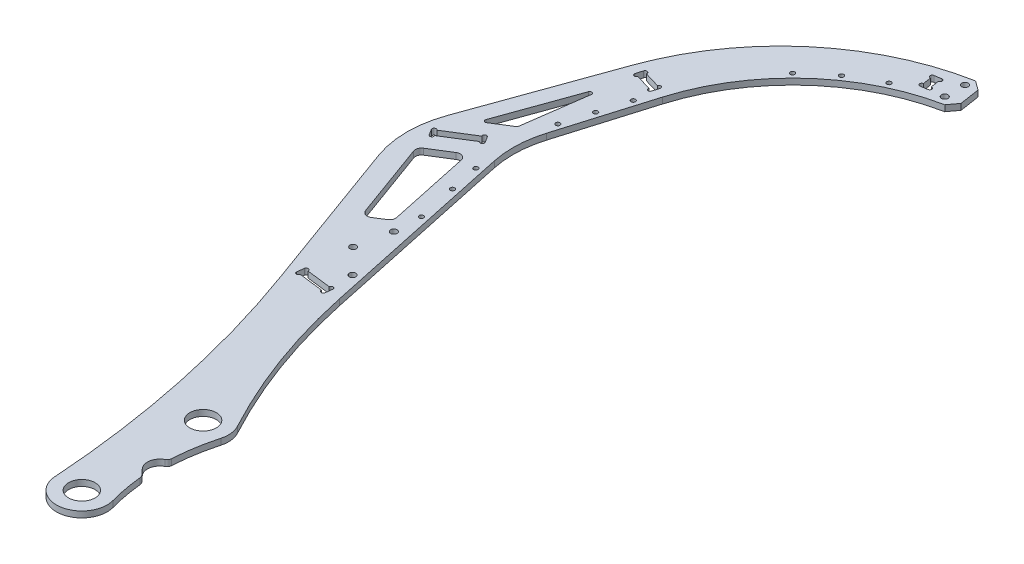
from build123d import *

# Parameters (mm, degrees)
SKETCH_3_R          = 6.55
EXTRUDE_1_DEPTH     = 1.5
CUT_EXTRUDE_3_DEPTH = 346.626566427
EXTRUDE_2_DEPTH     = 3
CHAMFER_1_SIZE      = 4
SKETCH_8_R          = 1
SKETCH_8_R_2        = 1.6
CUT_EXTRUDE_6_DEPTH = 345.981177834
SKETCH_9_R          = 1.1
SKETCH_9_R_2        = 1.6
CUT_EXTRUDE_7_DEPTH = 345.981177834
CUT_EXTRUDE_8_DEPTH = 345.981177834
FILLET_4_R          = 50
FILLET_5_R          = 3
FILLET_6_R          = 1
EXTRUDE_3_DEPTH     = 3


with BuildPart() as part:
    # 草图3 → 凸台-拉伸1 (new, symmetric)
    # profile 1 of 2: a face of its own
    with BuildSketch(Plane(origin=(0, 0, 0), x_dir=(1, 0, 0), z_dir=(0, 1, 0))):
        with BuildLine():
            ThreePointArc((11.046281859, 5.956690113), (-6.46534327, 44.807884696), (-18.295362458, 85.748365655))
            Line((-18.295362458, 85.748365655), (-41.732882117, 195.59746049))
            Line((-41.732882117, 195.59746049), (-24.830239517, 252.12165071))
            ThreePointArc((-24.830239517, 252.12165071), (4.01455016, 296.880361934), (52.313928116, 319.29763677))
            Line((52.313928116, 319.29763677), (49.5768988, 337.088327327))
            ThreePointArc((49.5768988, 337.088327327), (-8.975981148, 310.878563044), (-45.908014731, 258.424617632))
            Line((-45.908014731, 258.424617632), (-76.290123868, 173.944647702))
            Line((-76.290123868, 173.944647702), (-14.508857835, 4.202014333))
            ThreePointArc((-14.508857835, 4.202014333), (-13.227629582, 0.452324895), (-12.09596095, -3.34517992))
            ThreePointArc((-12.09596095, -3.34517992), (-4.680454366, 11.644562977), (11.046281859, 5.956690113))
        make_face()
    # profile 2 of 2: a face of its own
    with BuildSketch(Plane(origin=(0, 0, 0), x_dir=(1, 0, 0), z_dir=(0, 1, 0))):
        with BuildLine():
            ThreePointArc((12.09596095, -3.34517992), (8.478119914, -30), (12.09596095, -56.65482008))
            ThreePointArc((12.09596095, -56.65482008), (0, -72.55), (-12.09596095, -56.65482008))
            ThreePointArc((-12.09596095, -56.65482008), (-8.478119914, -30), (-12.09596095, -3.34517992))
            ThreePointArc((-12.09596095, -3.34517992), (0, 12.55), (12.09596095, -3.34517992))
        make_face()
        with Locations(Location((0, 0, 0), (0, 0, 270))):
            Circle(SKETCH_3_R, mode=Mode.SUBTRACT)
        with Locations(Location((0, -60, 0), (0, 0, 270))):
            Circle(SKETCH_3_R, mode=Mode.SUBTRACT)
    extrude(amount=EXTRUDE_1_DEPTH, both=True)

    # 草图7 → 切除-拉伸3 (cut, through all)
    with BuildSketch(Plane(origin=(0, 1.5, 0), x_dir=(1, 0, 0), z_dir=(0, 1, 0))):
        with BuildLine():
            Line((4.497487802, -34.493479197), (8.909760465, -39.281260509))
            ThreePointArc((8.909760465, -39.281260509), (8.493926314, -31.777928612), (8.642731975, -24.264556235))
            ThreePointArc((8.642731975, -24.264556235), (7.765481215, -25.952185157), (5.921402859, -26.418055622))
            ThreePointArc((5.921402859, -26.418055622), (1.171733543, -29.743809881), (4.497487802, -34.493479197))
        make_face()
    extrude(amount=-CUT_EXTRUDE_3_DEPTH, mode=Mode.SUBTRACT)

    # 草图7<3> → 凸台-拉伸2 (add)
    with BuildSketch(Plane(origin=(0, 1.5, 0), x_dir=(1, 0, 0), z_dir=(0, 1, 0))):
        with BuildLine():
            ThreePointArc((-8.909760465, -39.281260509), (-8.493926314, -31.777928612), (-8.642731975, -24.264556235))
            ThreePointArc((-8.642731975, -24.264556235), (-8.806680236, -25.524578384), (-9.419131852, -26.637878822))
            ThreePointArc((-9.419131852, -26.637878822), (-10.758632644, -29.837669281), (-10.103316411, -33.24405769))
            ThreePointArc((-10.103316411, -33.24405769), (-9.068630527, -36.176084637), (-8.909760465, -39.281260509))
        make_face()
    extrude(amount=-EXTRUDE_2_DEPTH)

    # 倒角1
    # the kernel refuses this chamfer: 4 mm, written as the material it takes off along each edge
    with BuildSketch(Plane(origin=(49.5768988, -11.786731952, -337.088327327), x_dir=(-0.9857681497508005, 0, 0.16811054380045146), z_dir=(0, 1, 0))) as chamfer_1_piece_1:
        with BuildLine():
            Line((3.936502909, 0), (CHAMFER_1_SIZE * 0.0162625743907, CHAMFER_1_SIZE * 0.999867755593))
            Line((CHAMFER_1_SIZE * 0.0162625743907, CHAMFER_1_SIZE * 0.999867755593), (0, 0))
            ThreePointArc((0, 0), (2.023873499, -0.015992695), (3.936502909, 0))
        make_face()
    extrude(amount=23.573463904, mode=Mode.SUBTRACT)
    with BuildSketch(Plane(origin=(52.313928116, -12.013080834, -319.29763677), x_dir=(-0.15205718425393844, 0, -0.9883716976506176), z_dir=(0, 1, 0))) as chamfer_1_piece_2:
        with BuildLine():
            Line((CHAMFER_1_SIZE, 0), (-0.087315026, 4.087315025))
            ThreePointArc((-0.087315026, 4.087315025), (-0.023083391, 2.101920628), (0, 0))
            Line((0, 0), (CHAMFER_1_SIZE, 0))
        make_face()
    extrude(amount=24.026161669, mode=Mode.SUBTRACT)

    # 草图8 → 切除-拉伸6 (cut, through all)
    with BuildSketch(Plane(origin=(0, 1.5, 0), x_dir=(1, 0, 0), z_dir=(0, 1, 0))):
        with Locations((37.433203796, 321.978777823)):
            Circle(SKETCH_8_R)
        with Locations((36.505654972, 328.007845179)):
            Circle(SKETCH_8_R)
        with Locations((33.1451912, 327.490850752)):
            Circle(SKETCH_8_R)
        with Locations((34.072740024, 321.461783396)):
            Circle(SKETCH_8_R)
        with Locations(Location((44.787418503, 332.089831456, 0), (0, 0, 270))):
            Circle(SKETCH_8_R_2)
        with Locations(Location((44.787418503, 322.089831456, 0), (0, 0, 270))):
            Circle(SKETCH_8_R_2)
        with Locations((-39.768291207, 258.363013678)):
            Circle(SKETCH_8_R)
        with Locations((-40.742386095, 255.105539327)):
            Circle(SKETCH_8_R)
        with Locations((-30.091676222, 255.469378864)):
            Circle(SKETCH_8_R)
        with Locations((-31.06577111, 252.211904513)):
            Circle(SKETCH_8_R)
        with Locations((-67.294758965, 181.587091045)):
            Circle(SKETCH_8_R)
        with Locations((-65.489494047, 178.705942216)):
            Circle(SKETCH_8_R)
        with Locations((-51.956878434, 191.197471934)):
            Circle(SKETCH_8_R)
        with Locations((-50.151613516, 188.316323105)):
            Circle(SKETCH_8_R)
        with Locations((-25.036284897, 88.28804372)):
            Circle(SKETCH_8_R)
        with Locations((-25.450272298, 84.913341595)):
            Circle(SKETCH_8_R)
        with Locations((-39.031373121, 90.004873825)):
            Circle(SKETCH_8_R)
        with Locations((-39.445360522, 86.6301717)):
            Circle(SKETCH_8_R)
        Polygon((36.353597787, 328.996216876), (37.58526098, 320.990406125), (34.224797208, 320.473411699), (32.993134015, 328.47922245), align=None)
        Polygon((-40.726371898, 258.649512175), (-29.133595531, 255.182880368), (-30.107690419, 251.925406016), (-41.700466786, 255.392037824), align=None)
        Polygon((-68.142155679, 181.056130775), (-51.10948172, 191.728432204), (-49.304216802, 188.847283375), (-66.336890761, 178.174981946), align=None)
        Polygon((-40.02393257, 90.126634825), (-24.043725449, 88.16628272), (-24.45771285, 84.791580595), (-40.437919971, 86.7519327), align=None)
    extrude(amount=-CUT_EXTRUDE_6_DEPTH, mode=Mode.SUBTRACT)

    # 草图9 → 切除-拉伸7 (cut, through all)
    with BuildSketch(Plane(origin=(0, 1.5, 0), x_dir=(1, 0, 0), z_dir=(0, 1, 0))):
        with Locations(Location((-30.569466556, 243.400339284, 0), (0, 0, 270))):
            Circle(SKETCH_9_R)
        with Locations(Location((25.150787489, 314.162258091, 0), (0, 0, 270))):
            Circle(SKETCH_9_R)
        with Locations(Location((10.249770173, 305.559151733, 0), (0, 0, 270))):
            Circle(SKETCH_9_R)
        with Locations(Location((-34.866944003, 229.02912891, 0), (0, 0, 270))):
            Circle(SKETCH_9_R)
        with Locations(Location((-2.930953467, 294.499211388, 0), (0, 0, 270))):
            Circle(SKETCH_9_R)
        with Locations(Location((-39.16442145, 214.657918537, 0), (0, 0, 270))):
            Circle(SKETCH_9_R)
        with Locations(Location((-40.493555813, 175.411721209, 0), (0, 0, 270))):
            Circle(SKETCH_9_R)
        with Locations(Location((-37.363589654, 160.741911673, 0), (0, 0, 270))):
            Circle(SKETCH_9_R)
        with Locations(Location((-33.190301442, 141.182165624, 0), (0, 0, 270))):
            Circle(SKETCH_9_R)
        with Locations(Location((-33.646848365, 128, 0), (0, 0, 270))):
            Circle(SKETCH_9_R_2)
        with Locations(Location((-25.254946433, 99.197639299, 0), (0, 0, 270))):
            Circle(SKETCH_9_R_2)
        with Locations(Location((-37.131526919, 111.360979134, 0), (0, 0, 270))):
            Circle(SKETCH_9_R_2)
    extrude(amount=-CUT_EXTRUDE_7_DEPTH, mode=Mode.SUBTRACT)

    # 草图10 → 切除-拉伸8 (cut, through all)
    with BuildSketch(Plane(origin=(0, 1.5, 0), x_dir=(1, 0, 0), z_dir=(0, 1, 0))):
        Polygon((-42.197304508, 245.103074872), (-59.836896552, 196.054728732), (-47.97334255, 203.488172514), align=None)
        Polygon((-64.127048511, 169.764916812), (-48.531264313, 179.536894505), (-38.537074534, 132.695218557), (-48.388180029, 126.522731048), align=None)
    extrude(amount=-CUT_EXTRUDE_8_DEPTH, mode=Mode.SUBTRACT)

    # 圆角4
    fillet_4_edges = [part.edges().sort_by_distance(p)[0] for p in [
        (-41.732882117, 0, -195.59746049),
        (-76.290123868, 0, -173.944647702),
    ]]
    fillet(fillet_4_edges, radius=FILLET_4_R)

    # 圆角5
    fillet_5_edges = [part.edges().sort_by_distance(p)[0] for p in [
        (-48.388180029, 0, -126.522731048),
        (-64.127048511, 0, -169.764916812),
        (-48.531264313, 0, -179.536894505),
        (-38.537074534, 0, -132.695218557),
        (4.497487802, 0, 34.493479197),
        (8.909760465, 0, 39.281260509),
    ]]
    fillet(fillet_5_edges, radius=FILLET_5_R)

    # 圆角6
    fillet_6_edges = [part.edges().sort_by_distance(p)[0] for p in [
        (-42.197304508, 0, -245.103074872),
        (-47.97334255, 0, -203.488172514),
        (-59.836896552, 0, -196.054728732),
    ]]
    fillet(fillet_6_edges, radius=FILLET_6_R)

    # 草图11 → 凸台-拉伸3 (add)
    with BuildSketch(Plane(origin=(0, 1.5, 0), x_dir=(1, 0, 0), z_dir=(0, 1, 0))):
        with BuildLine():
            ThreePointArc((3.862363202, -34.328152946), (4.521977485, -34.653012522), (5.082760511, -35.12856183))
            Line((5.082760511, -35.12856183), (5.760441827, -35.863917549))
            ThreePointArc((5.760441827, -35.863917549), (4.207468493, -30.616888071), (7.413296366, -26.182284124))
            ThreePointArc((7.413296366, -26.182284124), (6.687056269, -26.42486787), (5.921402859, -26.418055622))
            ThreePointArc((5.921402859, -26.418055622), (1.241668153, -29.422934282), (3.862363202, -34.328152946))
        make_face()
        with BuildLine():
            Line((-14.508857835, 4.202014333), (-42.305901268, 80.573763491))
            ThreePointArc((-42.305901268, 80.573763491), (-22.483207982, 11.333558383), (-12.55, -60))
            ThreePointArc((-12.55, -60), (-12.435972216, -58.312073746), (-12.09596095, -56.65482008))
            ThreePointArc((-12.09596095, -56.65482008), (-10.118516623, -48.038526559), (-8.909760465, -39.281260509))
            ThreePointArc((-8.909760465, -39.281260509), (-9.068630527, -36.176084637), (-10.103316411, -33.24405769))
            ThreePointArc((-10.103316411, -33.24405769), (-10.758632644, -29.837669281), (-9.419131852, -26.637878822))
            ThreePointArc((-9.419131852, -26.637878822), (-8.806680236, -25.524578384), (-8.642731975, -24.264556235))
            ThreePointArc((-8.642731975, -24.264556235), (-10.536060501, -9.817012165), (-14.508857835, 4.202014333))
        make_face()
    extrude(amount=-EXTRUDE_3_DEPTH)


solid = part.part
